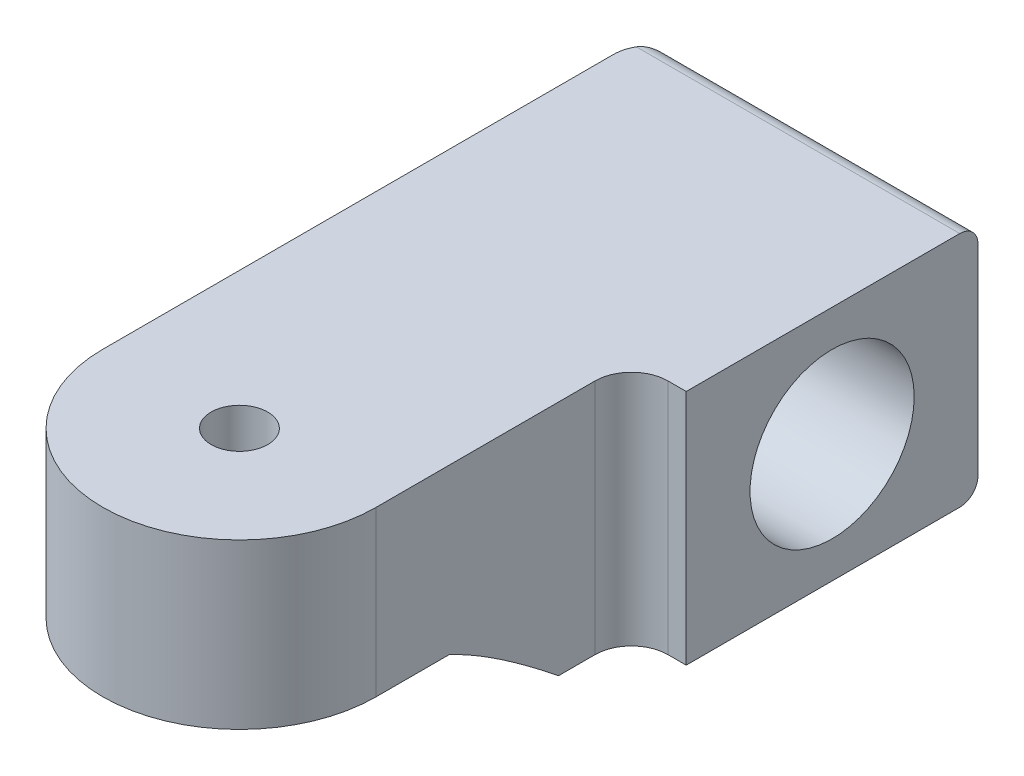
from build123d import *

# Parameters (mm, degrees)
BOSS_EXTRUDE1_DEPTH = 6.5
BOSS_EXTRUDE2_START = 6.5
SKETCH1_4_R         = 7.5
SKETCH1_4_R_2       = 1.55
BOSS_EXTRUDE2_DEPTH = 9
CUT_EXTRUDE1_DEPTH  = 15
CHAMFER1_SIZE       = 5
FILLET1_R           = 1
CUT_EXTRUDE2_DEPTH  = 3


with BuildPart() as part:
    # Sketch1 → Boss-Extrude1 (new, symmetric)
    with BuildSketch(Plane(origin=(0, 0, 0), x_dir=(1, 0, 0), z_dir=(0, 1, 0))):
        with BuildLine():
            Line((-1, 0), (0, 0))
            Line((0, 0), (0, 16))
            Line((0, 16), (-16, 16))
            ThreePointArc((-16, 16), (-17.414213562, 15.414213562), (-18, 14))
            Line((-18, 14), (-18, -14))
            ThreePointArc((-18, -14), (-10.5, -6.5), (-3, -14))
            Line((-3, -14), (-3, -2))
            ThreePointArc((-3, -2), (-2.414213562, -0.585786438), (-1, 0))
        make_face()
    extrude(amount=BOSS_EXTRUDE1_DEPTH, both=True)

    # Sketch1<4> → Boss-Extrude2 (add)
    with BuildSketch(Plane(origin=(0, 0, 0), x_dir=(1, 0, 0), z_dir=(0, 1, 0)).offset(BOSS_EXTRUDE2_START)):
        with Locations((-10.5, -14)):
            Circle(SKETCH1_4_R)
        with Locations(Location((-10.5, -14, 0), (0, 0, 270))):
            Circle(SKETCH1_4_R_2, mode=Mode.SUBTRACT)
    extrude(amount=-BOSS_EXTRUDE2_DEPTH)

    # Sketch2 → Cut-Extrude1 (cut)
    with BuildSketch(Plane(origin=(0, 0, 0), x_dir=(0, 0, -1), z_dir=(1, 0, 0))):
        with BuildLine():
            ThreePointArc((12.5, 0), (9.505604778, 4.240654932), (4.507486999, 2.837666813))
            Line((4.507486999, 2.837666813), (11.492513001, -2.837666813))
            ThreePointArc((11.492513001, -2.837666813), (12.240654932, -1.505604778), (12.5, 0))
        make_face()
        with BuildLine():
            Line((11.492513001, -2.837666813), (4.507486999, 2.837666813))
            ThreePointArc((4.507486999, 2.837666813), (5.162333187, -3.492513001), (11.492513001, -2.837666813))
        make_face()
    extrude(amount=-CUT_EXTRUDE1_DEPTH, mode=Mode.SUBTRACT)

    # Chamfer1
    # the kernel refuses this chamfer: 5 mm, written as the material it takes off along each edge
    with BuildSketch(Plane(origin=(-10.5, -6.5, 14), x_dir=(-0.003141587485879666, 0, 0.9999950652018581), z_dir=(0.9999950652018581, 0, 0.003141587485879666))) as chamfer1_piece_1_section:
        Polygon((7.5 + CHAMFER1_SIZE, 0), (7.5, -CHAMFER1_SIZE), (7.5, 0), align=None)
    chamfer1_piece_1 = revolve(axis=Axis((-10.5, -6.5, 14), (0, -1, 0)), revolution_arc=359.64, mode=Mode.PRIVATE)
    chamfer1_piece_1 = split(chamfer1_piece_1, bisect_by=Plane(origin=(-3, -4.630818152, 8.578188697), z_dir=(-1, 0, 0)), keep=Keep.TOP, mode=Mode.PRIVATE)
    chamfer1_piece_1 = split(chamfer1_piece_1, bisect_by=Plane(origin=(-19.50426243, -2.5, 8.578188697), z_dir=(0, -1, 0)), keep=Keep.TOP, mode=Mode.PRIVATE)
    add(chamfer1_piece_1, mode=Mode.SUBTRACT)
    with BuildSketch(Plane(origin=(-10.5, -6.5, 14), x_dir=(-0.003141587485879666, 0, 0.9999950652018581), z_dir=(0.9999950652018581, 0, 0.003141587485879666))) as chamfer1_piece_2_section:
        Polygon((7.5 + CHAMFER1_SIZE, 0), (7.5, -CHAMFER1_SIZE), (7.5, 0), align=None)
    chamfer1_piece_2 = revolve(axis=Axis((-10.5, -6.5, 14), (0, -1, 0)), revolution_arc=359.64, mode=Mode.PRIVATE)
    chamfer1_piece_2 = split(chamfer1_piece_2, bisect_by=Plane(origin=(-3, -5.259335852, 13.999999991), z_dir=(1, 0, 0)), keep=Keep.TOP, mode=Mode.PRIVATE)
    chamfer1_piece_2 = split(chamfer1_piece_2, bisect_by=Plane(origin=(-1.451043379, -2.5, 13.999999991), z_dir=(0, -1, 0)), keep=Keep.TOP, mode=Mode.PRIVATE)
    add(chamfer1_piece_2, mode=Mode.SUBTRACT)

    # Fillet1
    # the kernel refuses this fillet: 1 mm, written as the material it takes off along each edge
    with BuildSketch(Plane(origin=(2.5, -6.5, -16), x_dir=(0, 0, 1), z_dir=(-1, 0, 0)), Plane(origin=(2.5, 6.5, -16), x_dir=(0, -1, 0), z_dir=(-1, 0, 0))) as fillet1_piece_1:
        with BuildLine():
            CenterArc((FILLET1_R, FILLET1_R), FILLET1_R, 180, 90)
            Line((0, FILLET1_R), (0, 0))
            Line((0, 0), (FILLET1_R, 0))
        make_face()
    extrude(amount=21, mode=Mode.SUBTRACT)

    # Sketch3 → Cut-Extrude2 (cut)
    with BuildSketch(Plane.XZ.offset(2.5)):
        with BuildLine():
            Line((-7.477661315, 13.923391433), (-8.005921993, 15.110168858))
            Line((-8.005921993, 15.110168858), (-8.53418267, 16.296946283))
            ThreePointArc((-8.53418267, 16.296946283), (-8.690530367, 16.49005478), (-8.922485692, 16.579117797))
            Line((-8.922485692, 16.579117797), (-10.21439543, 16.715019342))
            Line((-10.21439543, 16.715019342), (-11.506305167, 16.850920888))
            ThreePointArc((-11.506305167, 16.850920888), (-11.75171588, 16.81207406), (-11.944824377, 16.655726364))
            Line((-11.944824377, 16.655726364), (-12.708473437, 15.604850484))
            Line((-12.708473437, 15.604850484), (-13.472122497, 14.553974605))
            ThreePointArc((-13.472122497, 14.553974605), (-13.561185513, 14.32201928), (-13.522338685, 14.076608567))
            Line((-13.522338685, 14.076608567), (-12.994078007, 12.889831142))
            Line((-12.994078007, 12.889831142), (-12.46581733, 11.703053717))
            ThreePointArc((-12.46581733, 11.703053717), (-12.309469633, 11.50994522), (-12.077514308, 11.420882203))
            Line((-12.077514308, 11.420882203), (-10.78560457, 11.284980658))
            Line((-10.78560457, 11.284980658), (-9.493694833, 11.149079112))
            ThreePointArc((-9.493694833, 11.149079112), (-9.24828412, 11.18792594), (-9.055175623, 11.344273636))
            Line((-9.055175623, 11.344273636), (-8.291526563, 12.395149516))
            Line((-8.291526563, 12.395149516), (-7.527877503, 13.446025395))
            ThreePointArc((-7.527877503, 13.446025395), (-7.438814487, 13.67798072), (-7.477661315, 13.923391433))
        make_face()
    extrude(amount=-CUT_EXTRUDE2_DEPTH, mode=Mode.SUBTRACT)


solid = part.part
